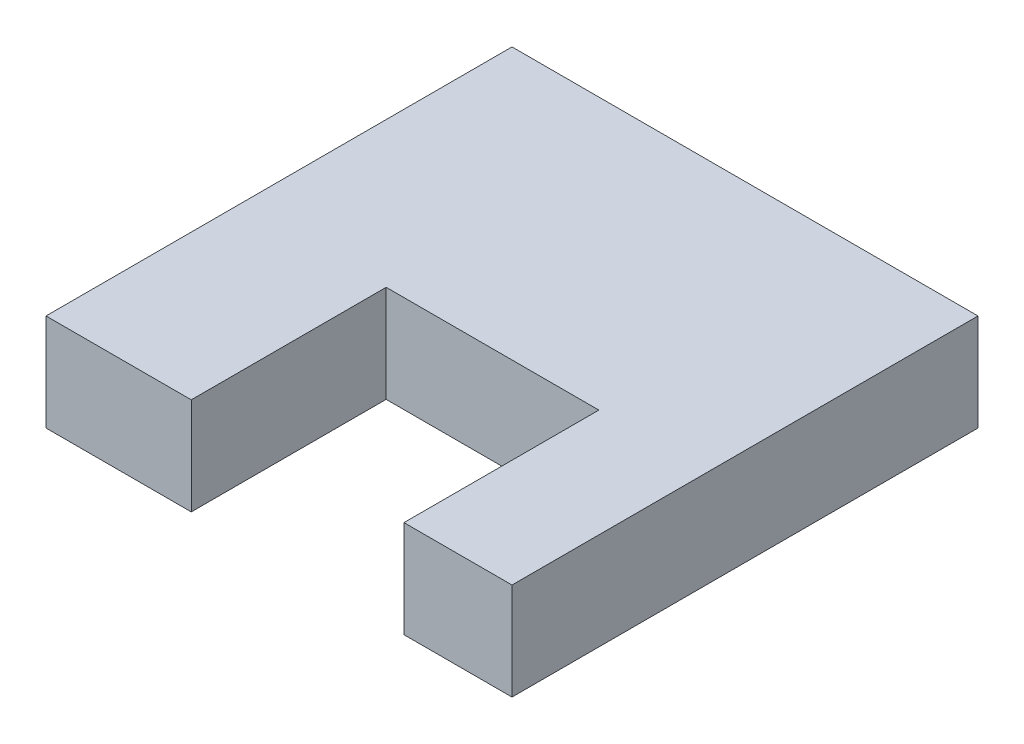
from build123d import *

# Parameters (mm, degrees)
BOSS_EXTRUDE1_DEPTH = 25


with BuildPart() as part:
    # Sketch1 → Boss-Extrude1 (new body)
    with BuildSketch(Plane(origin=(0, 0, 0), x_dir=(1, 0, 0), z_dir=(0, 1, 0))):
        Polygon((-60, -60), (-22.593310132, -60), (-22.593310132, -9.812494726), (32.177273624, -9.812494726), (32.177273624, -60), (60, -60), (60, 60), (-60, 60), align=None)
    extrude(amount=BOSS_EXTRUDE1_DEPTH)


solid = part.part
